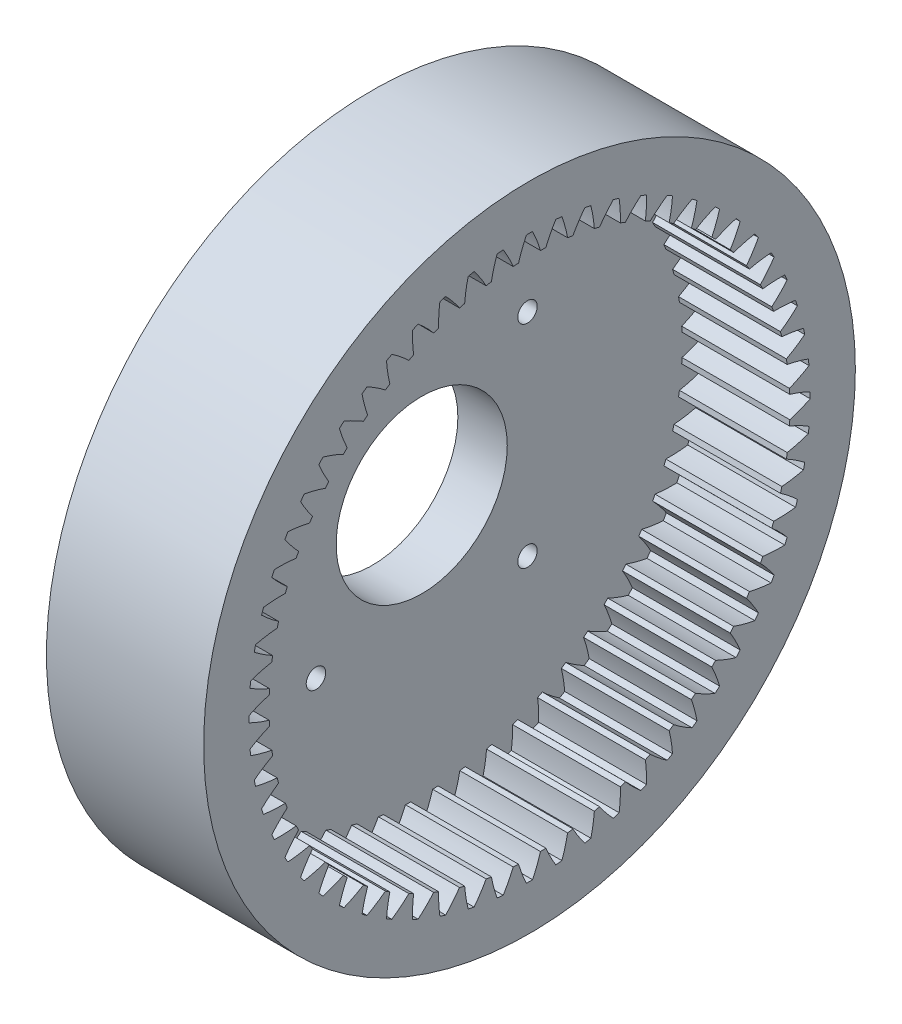
from build123d import *

# Parameters (mm, degrees)
BASPROSKE_W         = 12
BASPROSKE_H         = 2.2764
TOOTHCUT_DEPTH      = 46.830409053
TEETHCUTS_COUNT     = 60
TEETHCUTS_ANGLE     = 354
SCALE1_SCALE        = 2
SKETCH1_R           = 72.5528
SKETCH1_R_2         = 62.5528
EXTRUDE_THIN1_DEPTH = 35
SKETCH2_R           = 62.5528
BOSS_EXTRUDE1_DEPTH = 11
SKETCH3_R           = 19.05
CUT_EXTRUDE1_DEPTH  = 106.374653383
SKETCH5_R           = 2.165
CUT_EXTRUDE2_DEPTH  = 106.374653383


with BuildPart() as part:
    # BasProSke → Base-Revolve (revolve)
    with BuildSketch(Plane(origin=(0, 0, 0), x_dir=(1, 0, 0), z_dir=(0, 1, 0))):
        with Locations((6, 30.1382)):
            Rectangle(BASPROSKE_W, BASPROSKE_H)
    revolve(axis=Axis((-10, 0, 0), (1, 0, 0)))

    # TooCutSke → ToothCut (cut, through all)
    with BuildSketch(Plane(origin=(0, 0, 0), x_dir=(0, 0, -1), z_dir=(1, 0, 0))):
        with BuildLine():
            ThreePointArc((1.227357706, 28.948593027), (0.830805794, 30.117149174), (0.339543276, 31.24915537))
            ThreePointArc((0.339543276, 31.24915537), (0, 31.251), (-0.339543276, 31.24915537))
            ThreePointArc((-0.339543276, 31.24915537), (-0.830805794, 30.117149174), (-1.227357706, 28.948593027))
            ThreePointArc((-1.227357706, 28.948593027), (0, 28.9746), (1.227357706, 28.948593027))
        make_face()
    toothcut = extrude(amount=TOOTHCUT_DEPTH, mode=Mode.SUBTRACT)

    # TeethCuts: ToothCut ×60 about axis
    teethcuts_axis = Axis((-10, 0, 0), (1, 0, 0))
    for i in range(1, TEETHCUTS_COUNT):
        add(toothcut.rotate(teethcuts_axis, i * TEETHCUTS_ANGLE / (TEETHCUTS_COUNT - 1)), mode=Mode.SUBTRACT)


with BuildPart() as part_1:
    # Scale1: scaled about (6, 0, 0)
    add(part.part.scale(SCALE1_SCALE).moved(Location((-6, 0, 0))))



with BuildPart() as body_2:
    # Sketch1 → Extrude-Thin1 (new body)
    with BuildSketch(Plane(origin=(18, 0, 0), x_dir=(0, 0, -1), z_dir=(1, 0, 0))):
        Circle(SKETCH1_R)
        Circle(SKETCH1_R_2, mode=Mode.SUBTRACT)
    extrude(amount=-EXTRUDE_THIN1_DEPTH)


with BuildPart() as part_2:
    add(part_1.part)

    add(body_2.part)  # Boss-Extrude1 merges body 2
    # Sketch2 → Boss-Extrude1 (add)
    with BuildSketch(Plane.ZY.offset(6)):
        Circle(SKETCH2_R)
    extrude(amount=BOSS_EXTRUDE1_DEPTH)

    # Sketch3 → Cut-Extrude1 (cut, through all)
    with BuildSketch(Plane(origin=(-6, 0, 0), x_dir=(0, 0, -1), z_dir=(1, 0, 0))):
        Circle(SKETCH3_R)
    extrude(amount=-CUT_EXTRUDE1_DEPTH, mode=Mode.SUBTRACT)

    # Sketch5 → Cut-Extrude2 (cut, through all)
    with BuildSketch(Plane(origin=(-6, 0, 0), x_dir=(0, 0, -1), z_dir=(1, 0, 0))):
        with Locations((-23.55, 23.55)):
            Circle(SKETCH5_R)
        with Locations((-23.55, -23.55)):
            Circle(SKETCH5_R)
        with Locations((23.55, 23.55)):
            Circle(SKETCH5_R)
        with Locations((23.55, -23.55)):
            Circle(SKETCH5_R)
    extrude(amount=-CUT_EXTRUDE2_DEPTH, mode=Mode.SUBTRACT)


solid = part_2.part
